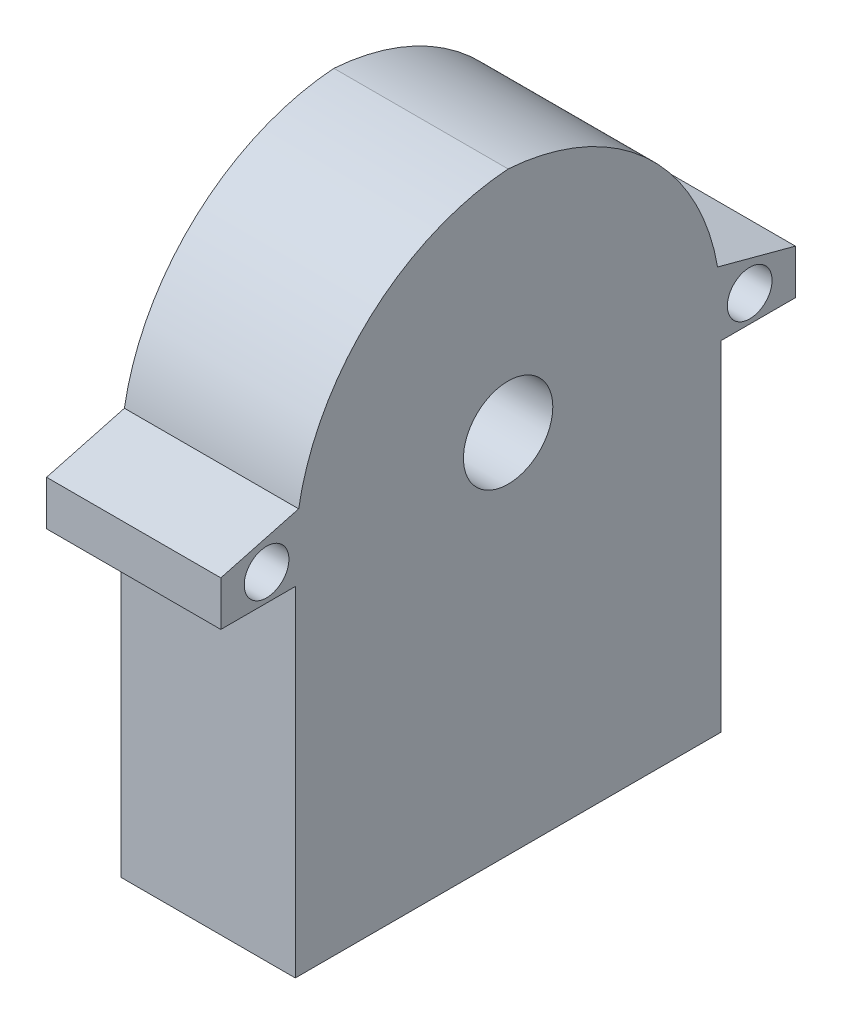
from build123d import *

# Parameters (mm, degrees)
SKETCH2_W           = 28.58
SKETCH2_H           = 39.94
BOSS_EXTRUDE1_DEPTH = 11.7
FILLET1_R           = 15.4
BOSS_EXTRUDE2_DEPTH = 11.7
SKETCH3_R           = 1.5
CUT_EXTRUDE1_DEPTH  = 11.7
SKETCH6_R           = 3
CUT_EXTRUDE2_DEPTH  = 11.7


with BuildPart() as part:
    # Sketch2 → Boss-Extrude1 (new body)
    with BuildSketch(Plane(origin=(0, 0, 0), x_dir=(0, 0, -1), z_dir=(1, 0, 0))):
        with Locations((-28.077336683, 0.926432161)):
            Rectangle(SKETCH2_W, SKETCH2_H)
    extrude(amount=BOSS_EXTRUDE1_DEPTH)

    # Fillet1
    # the kernel refuses this fillet: 15.4 mm, written as the material it takes off along each edge
    with BuildSketch(Plane(origin=(-38.5, 20.896432161, 13.787336683), x_dir=(0, -1, 0), z_dir=(1, 0, 0))) as fillet1_piece_1:
        with BuildLine():
            CenterArc((FILLET1_R, -FILLET1_R), FILLET1_R, 90, 90)
            Line((0, -FILLET1_R), (0, 0))
            Line((0, 0), (FILLET1_R, 0))
        make_face()
    extrude(amount=88.7, mode=Mode.SUBTRACT)
    with BuildSketch(Plane(origin=(-38.5, 20.896432161, 42.367336683), x_dir=(0, -1, 0), z_dir=(1, 0, 0))) as fillet1_piece_2:
        with BuildLine():
            CenterArc((FILLET1_R, FILLET1_R), FILLET1_R, 180, 90)
            Line((0, FILLET1_R), (0, 0))
            Line((0, 0), (FILLET1_R, 0))
        make_face()
    extrude(amount=88.7, mode=Mode.SUBTRACT)

    # Sketch5 → Boss-Extrude2 (add)
    with BuildSketch(Plane(origin=(11.7, 0, 0), x_dir=(0, 0, -1), z_dir=(1, 0, 0))):
        Polygon((-42.141577226, 8.123678622), (-47.367336683, 6.723440596), (-47.367336683, 3.723440596), (-42.367336683, 3.723440596), align=None)
        Polygon((-13.787336683, 3.723440596), (-8.787336683, 3.723440596), (-8.787336683, 6.723440596), (-14.013096141, 8.123678622), align=None)
    extrude(amount=-BOSS_EXTRUDE2_DEPTH)

    # Sketch3 → Cut-Extrude1 (cut)
    with BuildSketch(Plane(origin=(11.7, 0, 0), x_dir=(0, 0, -1), z_dir=(1, 0, 0))):
        with Locations((-44.297336683, 5.526376822)):
            Circle(SKETCH3_R)
        with Locations((-11.857336683, 5.526376822)):
            Circle(SKETCH3_R)
    extrude(amount=-CUT_EXTRUDE1_DEPTH, mode=Mode.SUBTRACT)

    # Sketch6 → Cut-Extrude2 (cut)
    with BuildSketch(Plane(origin=(11.7, 0, 0), x_dir=(0, 0, -1), z_dir=(1, 0, 0))):
        with Locations((-28.077336683, 5.526376822)):
            Circle(SKETCH6_R)
    extrude(amount=-CUT_EXTRUDE2_DEPTH, mode=Mode.SUBTRACT)


solid = part.part
